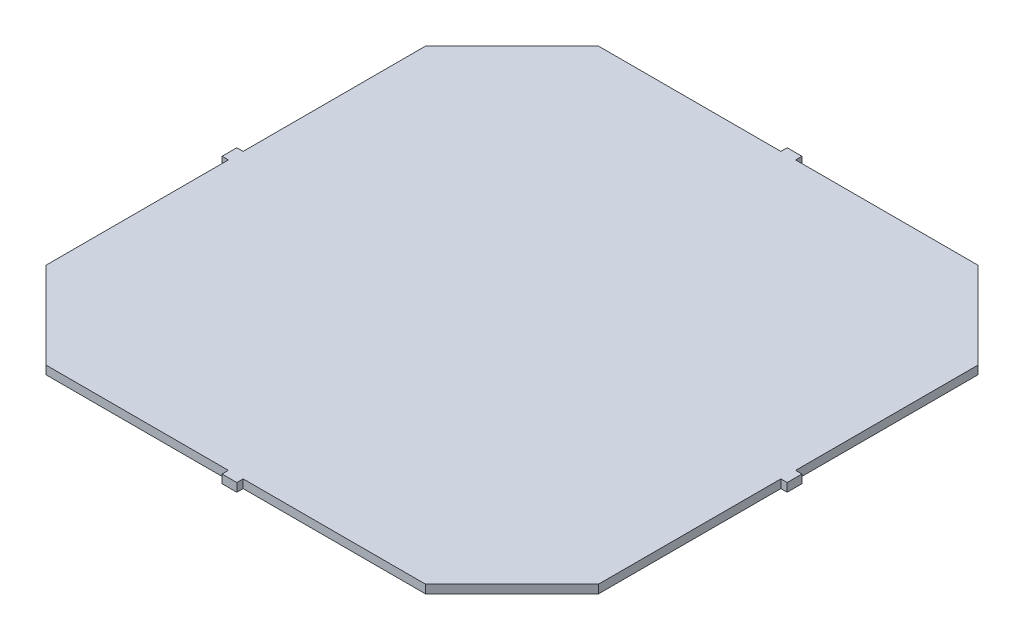
from build123d import *

# Parameters (mm, degrees)
BOSS_EXTRUDE1_DEPTH = 1
SKETCH2_W           = 0.75
SKETCH2_H           = 1.75
SKETCH2_W_2         = 1.75
SKETCH2_H_2         = 0.75
BOSS_EXTRUDE2_DEPTH = 1


with BuildPart() as part:
    # Sketch1 → Boss-Extrude1 (new body)
    with BuildSketch(Plane(origin=(0, 0, 0), x_dir=(1, 0, 0), z_dir=(0, 1, 0))):
        Polygon((-32.753048327, 22.5), (-22.5, 32.753048327), (22.5, 32.753048327), (32.753048327, 22.5), (32.753048327, -22.5), (22.5, -32.753048327), (-22.5, -32.753048327), (-32.753048327, -22.5), align=None)
    extrude(amount=BOSS_EXTRUDE1_DEPTH)

    # Sketch2 → Boss-Extrude2 (add)
    with BuildSketch(Plane(origin=(0, 1, 0), x_dir=(1, 0, 0), z_dir=(0, 1, 0))):
        with Locations((33.128048327, 0)):
            Rectangle(SKETCH2_W, SKETCH2_H)
        with Locations((0, 33.128048327)):
            Rectangle(SKETCH2_W_2, SKETCH2_H_2)
        with Locations((-33.128048327, 0)):
            Rectangle(SKETCH2_W, SKETCH2_H)
        with Locations((0, -33.128048327)):
            Rectangle(SKETCH2_W_2, SKETCH2_H_2)
    extrude(amount=-BOSS_EXTRUDE2_DEPTH)


solid = part.part
